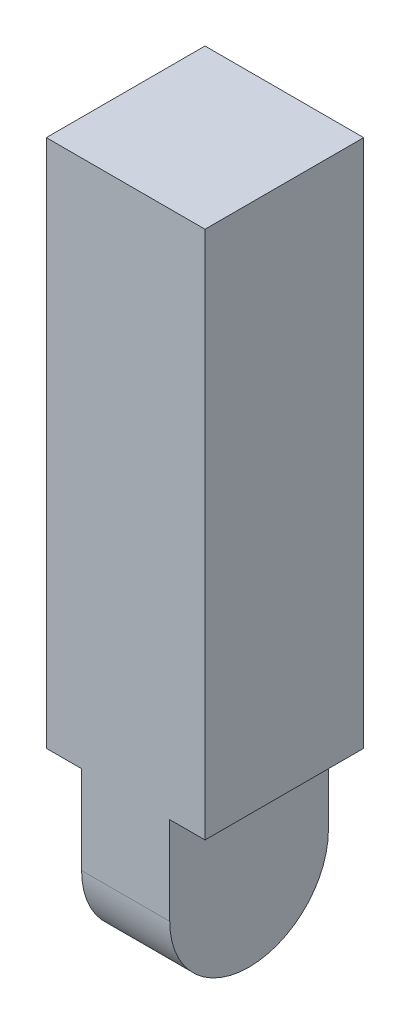
from build123d import *

# Parameters (mm, degrees)
SKETCH_1_W      = 18
SKETCH_1_H      = 18
EXTRUDE_1_DEPTH = 60
EXTRUDE_2_DEPTH = 5


with BuildPart() as part:
    # 草图1 → 凸台-拉伸1 (new body)
    with BuildSketch(Plane(origin=(0, 0, 0), x_dir=(1, 0, 0), z_dir=(0, 1, 0))):
        Rectangle(SKETCH_1_W, SKETCH_1_H)
    extrude(amount=EXTRUDE_1_DEPTH)

    # 草图2 → 凸台-拉伸2 (add, symmetric)
    with BuildSketch(Plane(origin=(0, 0, 0), x_dir=(0, 0, -1), z_dir=(1, 0, 0))):
        with BuildLine():
            Line((-9, -10), (-9, 1.037830192))
            Line((-9, 1.037830192), (9, 1.037830192))
            Line((9, 1.037830192), (9, -10))
            ThreePointArc((9, -10), (0, -19), (-9, -10))
        make_face()
    extrude(amount=EXTRUDE_2_DEPTH, both=True)


solid = part.part
